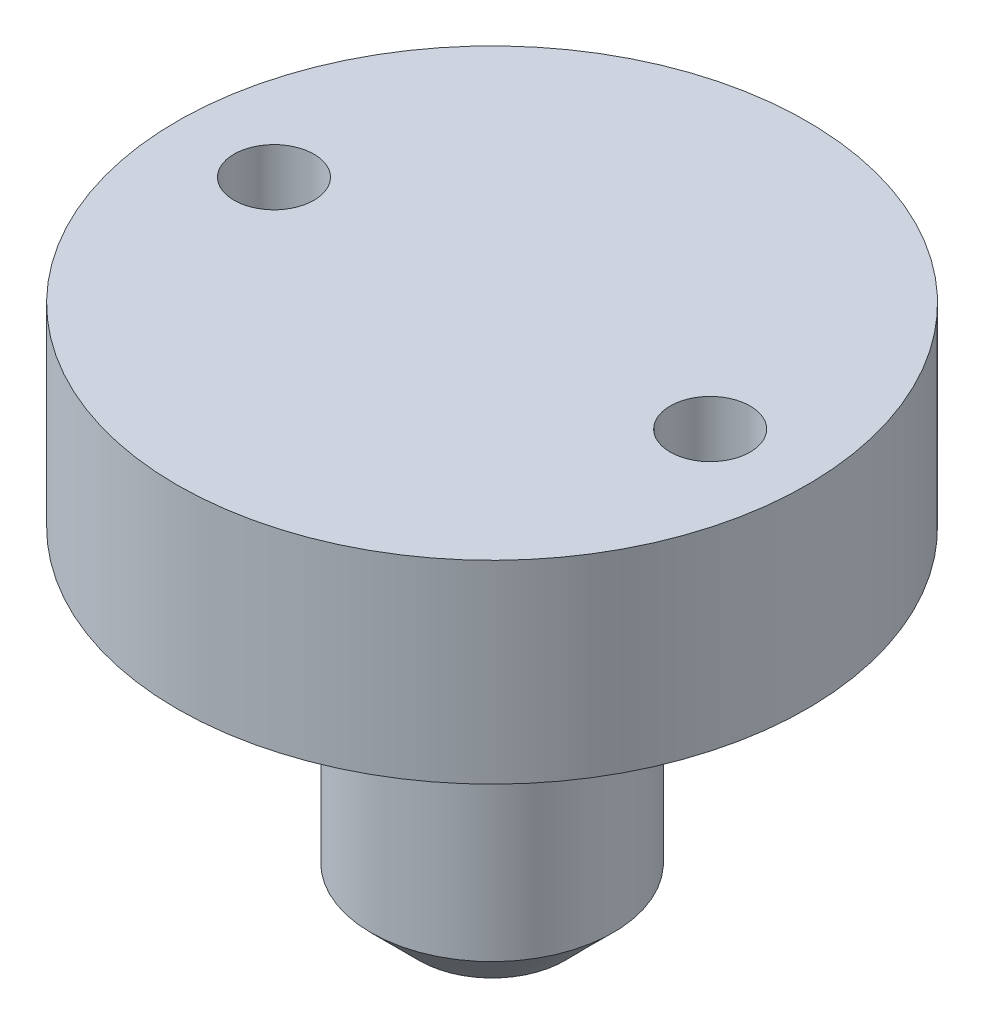
from build123d import *

# Parameters (mm, degrees)
CHAMFER_1_SIZE         = 2
HOLE_WIZARD_M4_1_D     = 3.3
HOLE_WIZARD_M4_1_DEPTH = 4
HOLE_WIZARD_M4_1_TIP   = 0.991420021


with BuildPart() as part:
    # 草图1 → 旋转1 (revolve)
    with BuildSketch(Plane.XY):
        Polygon((0, 0), (5, 0), (5, 12), (4, 12), (4, 14), (13, 14), (13, 22), (0, 22), align=None)
    revolve(axis=Axis((0, 60.790955631, 0), (0, -1, 0)))

    # 倒角1
    chamfer_1_edges = [part.edges().sort_by_distance(p)[0] for p in [
        (-5, 0, 0),
    ]]
    chamfer(chamfer_1_edges, length=CHAMFER_1_SIZE)

    # M4 螺纹孔的螺纹孔钻头1
    with Locations(Plane(origin=(0, 22, 0), x_dir=(-1, 0, 0), z_dir=(0, 1, 0))):
        with Locations((9, 0), (-9, 0)):
            Hole(HOLE_WIZARD_M4_1_D / 2, depth=HOLE_WIZARD_M4_1_DEPTH)
            with Locations((0, 0, -(HOLE_WIZARD_M4_1_DEPTH + HOLE_WIZARD_M4_1_TIP / 2))):  # 118° drill point
                Cone(0, HOLE_WIZARD_M4_1_D / 2, HOLE_WIZARD_M4_1_TIP, mode=Mode.SUBTRACT)


solid = part.part
